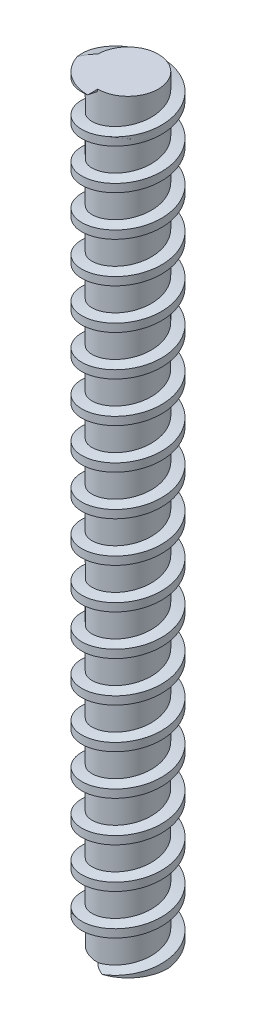
from build123d import *

# Parameters (mm, degrees)
SKETCH1_R           = 3
BOSS_EXTRUDE1_DEPTH = 85
SWEEP2_PITCH        = 4
SKETCH7_R           = 4.758391177
CUT_EXTRUDE6_DEPTH  = 7
SKETCH5_R           = 4.918691768
CUT_EXTRUDE7_DEPTH  = 10


with BuildPart() as part:
    # Sketch1 → Boss-Extrude1 (new body)
    with BuildSketch(Plane(origin=(0, 0, 0), x_dir=(1, 0, 0), z_dir=(0, 1, 0))):
        with Locations(Location((0, 0, 0), (0, 0, 270))):
            Circle(SKETCH1_R)
    extrude(amount=BOSS_EXTRUDE1_DEPTH)

    # Sweep2: arcs per turn and ends read off the stored shape
    # Sweep2: the profile of Sketch3 profile screwed along a right-hand helix through 21 turns, 12 arcs to a turn; built about Z, then put on its axis
    sweep2_z = Axis((0, 0, 0), (0, 0, 1))
    sweep2_corners = [(2.9997, 0, -1.00006), (4, 0, -0.8), (4, 0, 0), (2.9997, 0, 0.20006)]
    with BuildLine(mode=Mode.PRIVATE) as sweep2_profile:
        Line(sweep2_corners[0], sweep2_corners[1])
        Line(sweep2_corners[1], sweep2_corners[2])
        Line(sweep2_corners[2], sweep2_corners[3])
        Line(sweep2_corners[3], sweep2_corners[0])
    sweep2_cap = Face(sweep2_profile.wire())
    sweep2_turn_angles = [0, 15, 30, 45, 60, 75, 90, 105, 120, 135, 150, 165, 180, 195, 210, 225, 240, 255, 270, 285, 300, 315, 330, 345, 360]
    sweep2_turn_weights = [1, 0.9659258262890683, 1, 0.9659258262890683, 1, 0.9659258262890683, 1, 0.9659258262890683, 1, 0.9659258262890683, 1, 0.9659258262890683, 1, 0.9659258262890683, 1, 0.9659258262890683, 1, 0.9659258262890683, 1, 0.9659258262890683, 1, 0.9659258262890683, 1, 0.9659258262890683, 1]
    sweep2_turn_rails = [Edge.make_bspline([Vector(p[0], p[1], 0).rotate(sweep2_z, sweep2_turn_angles[k]) / sweep2_turn_weights[k] + Vector(0, 0, p[2] + SWEEP2_PITCH * sweep2_turn_angles[k] / 360) for k in range(25)], [0, 0, 0, 1, 1, 2, 2, 3, 3, 4, 4, 5, 5, 6, 6, 7, 7, 8, 8, 9, 9, 10, 10, 11, 11, 12, 12, 12], 2, sweep2_turn_weights) for p in sweep2_corners]
    sweep2_turn_sides = [Face.make_surface_from_curves(sweep2_turn_rails[p[0]], sweep2_turn_rails[p[1]]) for p in [(0, 1), (1, 2), (2, 3), (3, 0)]]
    sweep2 = Plane(origin=(0, 85, 0), x_dir=(0, 0, 1), z_dir=(0, -1, 0)) * Solid(Shell([*[p.moved(Location((0, 0, SWEEP2_PITCH * i))) for i in range(21) for p in sweep2_turn_sides], sweep2_cap, sweep2_cap.rotate(sweep2_z, 7560).moved(Location((0, 0, SWEEP2_PITCH * 7560 / 360)))]))
    add(sweep2)

    # Sketch7 → Cut-Extrude6 (cut)
    with BuildSketch(Plane(origin=(0, 85, 0), x_dir=(1, 0, 0), z_dir=(0, 1, 0))):
        Circle(SKETCH7_R)
    extrude(amount=CUT_EXTRUDE6_DEPTH, mode=Mode.SUBTRACT)

    # Sketch5 → Cut-Extrude7 (cut)
    with BuildSketch(Plane.XZ):
        Circle(SKETCH5_R)
    extrude(amount=-CUT_EXTRUDE7_DEPTH, mode=Mode.SUBTRACT)


solid = part.part
